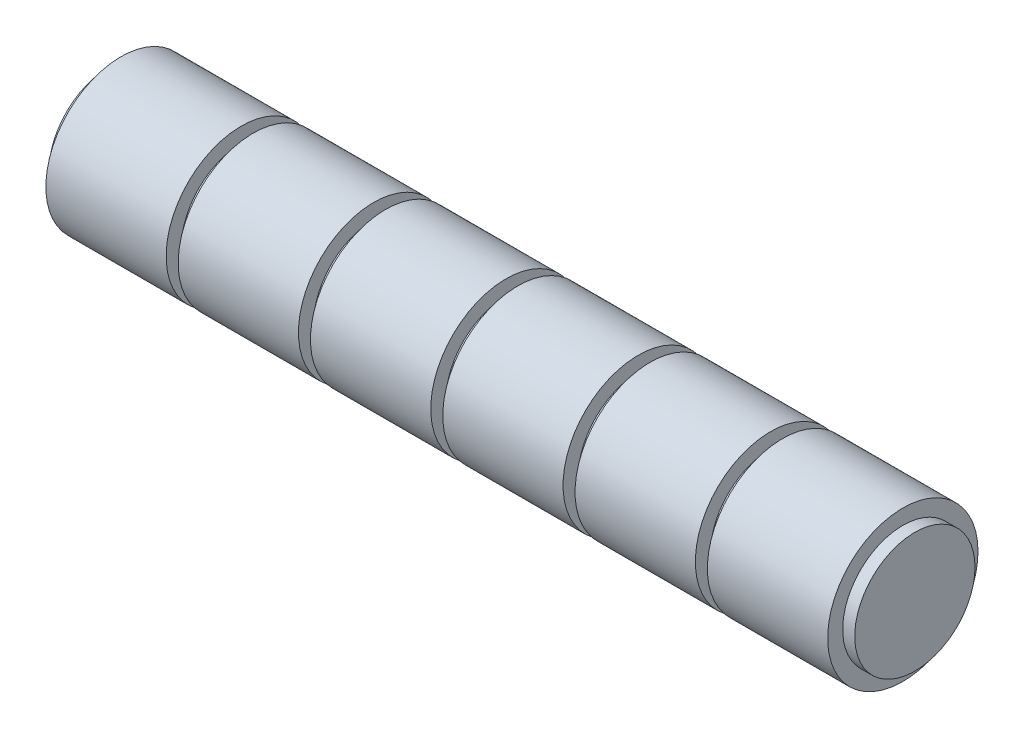
from build123d import *

# Parameters (mm, degrees)
SKETCH1_R             = 12.5
BOSS_EXTRUDE1_DEPTH   = 20
SKETCH2_R             = 10
BOSS_EXTRUDE2_DEPTH   = 2
LPATTERN4_START       = 22
LPATTERN4_OUTLINE_R   = 12.5
LPATTERN4_DEPTH       = 20
LPATTERN4_START_2     = -2
LPATTERN4_2_OUTLINE_R = 10
LPATTERN4_2_DEPTH     = 46
LPATTERN5_COUNT       = 5
LPATTERN5_PITCH       = 22


# Read off the part's stored shape, not the designer's step: LPattern4
with BuildPart() as part:
    # Sketch1 → Boss-Extrude1 (new body)
    with BuildSketch(Plane(origin=(0, 0, 0), x_dir=(0, 0, -1), z_dir=(1, 0, 0))):
        Circle(SKETCH1_R)
    boss_extrude1 = extrude(amount=BOSS_EXTRUDE1_DEPTH)

    # Sketch2 → Boss-Extrude2 (add)
    with BuildSketch(Plane(origin=(20, 0, 0), x_dir=(0, 0, -1), z_dir=(1, 0, 0))):
        Circle(SKETCH2_R)
    extrude(amount=BOSS_EXTRUDE2_DEPTH)

    # LPattern4 outline → LPattern4 (add)
    with BuildSketch(Plane.YZ.offset(LPATTERN4_START)):
        Circle(LPATTERN4_OUTLINE_R)
    lpattern4 = extrude(amount=LPATTERN4_DEPTH)

    # LPattern4 2 outline → LPattern4 2 (add)
    with BuildSketch(Plane.YZ.offset(LPATTERN4_START_2)):
        Circle(LPATTERN4_2_OUTLINE_R)
    lpattern4_2 = extrude(amount=LPATTERN4_2_DEPTH)

    # LPattern5: Boss-Extrude1, LPattern4, LPattern4 2 ×5
    with Locations(*[(-i * LPATTERN5_PITCH, 0, 0) for i in range(1, LPATTERN5_COUNT)]):
        add(boss_extrude1)
        add(lpattern4)
        add(lpattern4_2)


solid = part.part
